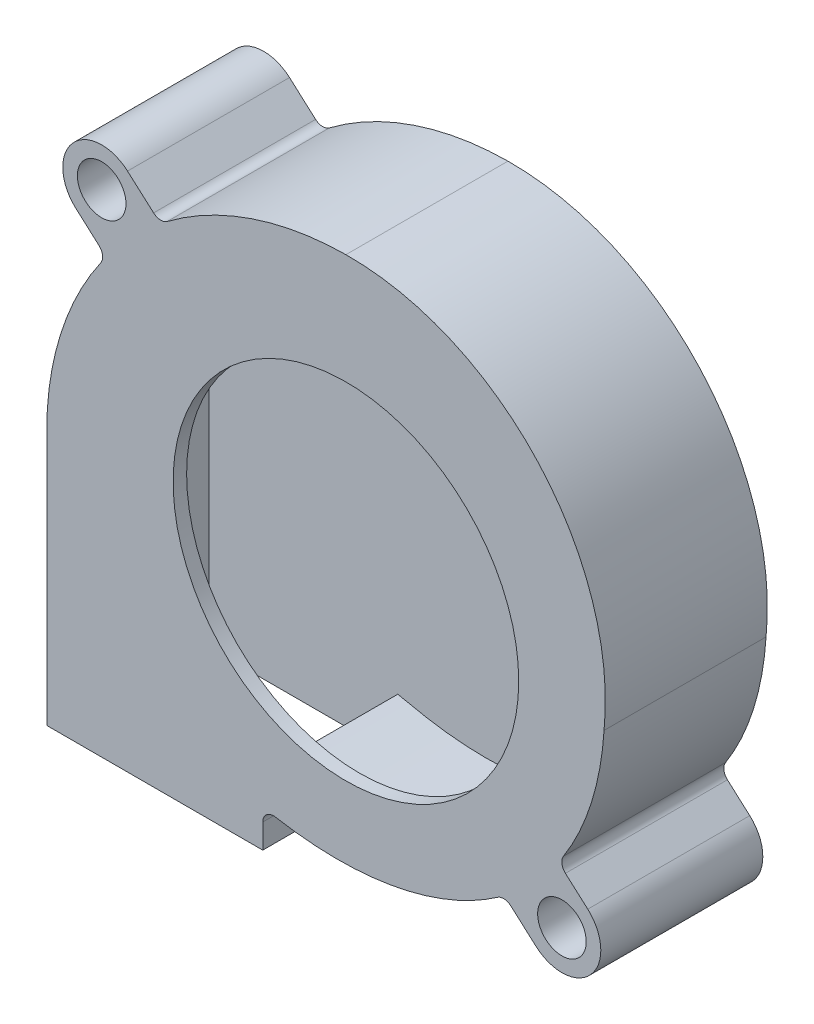
from build123d import *

# Parameters (mm, degrees)
BOSS_EXTRUDE1_DEPTH      = 7.5
BOSS_EXTRUDE1_DEPTH_BACK = 7.5
SKETCH2_R                = 2.25
SHELL1_START             = -6.25
SHELL1_DEPTH             = 12.5
CUT_EXTRUDE1_REACH       = 42.973
SKETCH3_R                = 16
FILLET1_R                = 1


# Read off the part's stored shape, not the designer's step: Shell1
with BuildPart() as part:
    # Sketch2 → Boss-Extrude1 (new, two sides: drawn at the far end of the back side and taken through both)
    with BuildSketch(Plane.XY.offset(-BOSS_EXTRUDE1_DEPTH_BACK)):
        with BuildLine():
            Line((-27.7, -1.754714302), (-27.7, -25.4))
            Line((-27.7, -25.4), (-7.7, -25.4))
            Line((-7.7, -25.4), (-7.7, -21.934994614))
            add(Edge.make_bspline(
                [(-7.7, -21.934994614), (1.089505829, -23.776714198), (8.970252681, -22.10862964), (14.671105933, -17.856437337)],
                knots=[0, 0, 0, 0, 0.517783655, 0.517783655, 0.517783655, 0.517783655], degree=3))
            Line((14.671105933, -17.856437337), (17.608394445, -20.467156716))
            ThreePointArc((17.608394445, -20.467156716), (22.690766223, -20.167996048), (22.391605555, -15.085624269))
            Line((22.391605555, -15.085624269), (19.673138844, -12.669397979))
            add(Edge.make_bspline(
                [(19.673138844, -12.669397979), (22.084739228, -9.177460006), (23.581545529, -4.890349215), (23.9, 0)],
                knots=[0.693538152, 0.693538152, 0.693538152, 0.693538152, 1, 1, 1, 1], degree=3))
            ThreePointArc((23.9, 0), (17.803458828, 18.439605572), (0, 26.2))
            ThreePointArc((0, 26.2), (-9.105433904, 24.587214818), (-17.186614263, 20.092270255))
            Line((-17.186614263, 20.092270255), (-20.222659144, 22.790766223))
            ThreePointArc((-20.222659144, 22.790766223), (-25.305030923, 22.491605555), (-25.005870255, 17.409233777))
            Line((-25.005870255, 17.409233777), (-22.191609365, 14.907863751))
            ThreePointArc((-22.191609365, 14.907863751), (-26.28720334, 7.020020377), (-27.7, -1.754714302))
        make_face()
        with Locations((20, -17.776390493)):
            Circle(SKETCH2_R, mode=Mode.SUBTRACT)
        with Locations((-22.6142647, 20.1)):
            Circle(SKETCH2_R, mode=Mode.SUBTRACT)
    extrude(amount=BOSS_EXTRUDE1_DEPTH + BOSS_EXTRUDE1_DEPTH_BACK)

    # Shell1 outline → Shell1 (cut)
    with BuildSketch(Plane.XY.offset(SHELL1_START)):
        with BuildLine():
            Line((19.622532896, -14.296804513), (18.016150224, -12.869020231))
            add(Edge.make_bspline(
                [(18.016150224, -12.869020231), (18.051576945, -12.817723211), (18.087003667, -12.766426191), (18.122430388, -12.715129171), (18.157857109, -12.66383215), (18.193283831, -12.612535131), (18.228710551, -12.56123811), (18.264137274, -12.50994109), (18.299563994, -12.45864407), (18.334990716, -12.40734705), (18.370417437, -12.35605003), (18.405844159, -12.30475301), (18.44127088, -12.25345599), (18.476697601, -12.20215897), (18.520981003, -12.138037694), (18.529837683, -12.125213439), (18.538694363, -12.112389184), (18.547551044, -12.099564929), (18.556407724, -12.086740674), (18.565264404, -12.073916419), (18.574121085, -12.061092164), (18.582977765, -12.048267909), (18.591834446, -12.035443654), (18.600691126, -12.022619399), (18.609547806, -12.009795144), (18.618404486, -11.996970889), (18.627261167, -11.984146634), (18.636671389, -11.970520863), (18.637224932, -11.969719347), (18.637778474, -11.968917831), (18.638332017, -11.968116315), (18.638885559, -11.967314799), (18.639439102, -11.966513284), (18.639992644, -11.965711767), (18.640546187, -11.964910252), (18.64109973, -11.964108735), (18.641653272, -11.96330722), (18.642206815, -11.962505704), (18.642760357, -11.961704188), (18.6433139, -11.960902672), (18.643936635, -11.960000966), (18.644007721, -11.959898036), (18.644065014, -11.959815075), (18.644167659, -11.959666454), (18.644187428, -11.959637822), (18.644283855, -11.9594982), (18.644383013, -11.959354625), (18.644395371, -11.959336729), (18.644469199, -11.959229822), (18.644608909, -11.959027533), (18.644602592, -11.959036679), (18.644696049, -11.958901353), (18.644756897, -11.958813245), (18.644887565, -11.958624032), (18.644952899, -11.958529425), (18.645018233, -11.958434817), (18.645083566, -11.958340209), (18.645148897, -11.958245601), (18.64521423, -11.958150993), (18.64527956, -11.958056383), (18.645344892, -11.957961774), (18.645410222, -11.957867163), (18.645475552, -11.957772553), (18.645540881, -11.957677942), (18.64560621, -11.957583331), (18.645671538, -11.957488719), (18.645867521, -11.957204882), (18.645998175, -11.957015655), (18.646128827, -11.956826427), (18.646259476, -11.956637197), (18.646390124, -11.956447965), (18.646520768, -11.956258731), (18.646651413, -11.956069496), (18.646782053, -11.955880258), (18.646912693, -11.95569102), (18.64704333, -11.955501779), (18.647173965, -11.955312536), (18.647304598, -11.955123292), (18.64743523, -11.954934045), (18.647827117, -11.954366301), (18.648088368, -11.953987798), (18.64834961, -11.953609287), (18.648610844, -11.95323077), (18.648872069, -11.952852245), (18.649133288, -11.952473713), (18.649394497, -11.952095174), (18.649655699, -11.951716627), (18.649916892, -11.951338074), (18.650178078, -11.950959513), (18.650439255, -11.950580945), (18.650700424, -11.95020237), (18.650961585, -11.949823787), (18.65226735, -11.947930839), (18.653311833, -11.946416366), (18.654356185, -11.944901777), (18.655400408, -11.943387074), (18.656444501, -11.941872255), (18.657488465, -11.940357322), (18.658532298, -11.938842273), (18.659576002, -11.937327109), (18.660619576, -11.93581183), (18.661663021, -11.934296437), (18.662706335, -11.932780928), (18.66374952, -11.931265304), (18.664792575, -11.929749565), (18.667921351, -11.925202003), (18.670006683, -11.922169835), (18.672091495, -11.919137207), (18.674175788, -11.916104119), (18.676259561, -11.913070571), (18.678342816, -11.910036563), (18.680425551, -11.907002096), (18.682507767, -11.903967167), (18.684589463, -11.90093178), (18.68667064, -11.897895932), (18.688751296, -11.894859625), (18.690831434, -11.891822858), (18.692911052, -11.888785631), (18.699148345, -11.879672571), (18.703304462, -11.873595358), (18.7074585, -11.867516307), (18.711610458, -11.861435418), (18.715760335, -11.85535269), (18.719908132, -11.849268125), (18.724053848, -11.843181721), (18.728197483, -11.83709348), (18.732339035, -11.831003402), (18.736478506, -11.824911486), (18.740615894, -11.818817734), (18.744751199, -11.812722145), (18.748884421, -11.80662472), (18.769540109, -11.776128414), (18.786031319, -11.751701992), (18.802489161, -11.727246206), (18.818913609, -11.702761073), (18.835304639, -11.678246607), (18.851662221, -11.653702823), (18.867986333, -11.629129738), (18.884276945, -11.604527363), (18.900534033, -11.579895716), (18.91675757, -11.555234811), (18.932947531, -11.530544664), (18.949103888, -11.505825288), (18.965226617, -11.4810767), (19.04567198, -11.357187769), (19.10948985, -11.25760948), (19.172767579, -11.157564989), (19.235503448, -11.057055241), (19.297695737, -10.956081176), (19.359342728, -10.85464374), (19.420442701, -10.752743874), (19.480993936, -10.650382523), (19.540994714, -10.547560629), (19.600443315, -10.444279135), (19.659338021, -10.340538985), (19.717677112, -10.236341121), (19.775458869, -10.131686486), (19.947126977, -9.816355101), (20.059335888, -9.604310842), (20.16929426, -9.390450666), (20.276987945, -9.174781998), (20.382402688, -8.957312267), (20.485524131, -8.738048908), (20.586337811, -8.516999358), (20.684829159, -8.294171063), (20.780983502, -8.06957147), (20.874786063, -7.843208033), (20.966221959, -7.61508821), (21.055276202, -7.385219464), (21.1419337, -7.153609263), (21.310424813, -6.686920896), (21.392258464, -6.45184282), (21.471664997, -6.215038335), (21.548629109, -5.976514973), (21.623135411, -5.736280308), (21.695168429, -5.494341964), (21.764712594, -5.250707611), (21.831752262, -5.005384963), (21.896271688, -4.758381783), (21.958255052, -4.50970588), (22.017686437, -4.259365107), (22.074549845, -4.007367366), (22.128829187, -3.753720604), (22.20634784, -3.370788921), (22.231537383, -3.242734734), (22.256074879, -3.114271279), (22.279958285, -2.985399584), (22.30318556, -2.856120672), (22.325754665, -2.726435571), (22.347663554, -2.596345306), (22.368910193, -2.465850903), (22.389492535, -2.334953386), (22.409408542, -2.203653784), (22.428656171, -2.07195312), (22.447233383, -1.939852421), (22.465138135, -1.807352712), (22.490983513, -1.608006173), (22.499430005, -1.54145784), (22.507707606, -1.474810151), (22.515816054, -1.408063241), (22.523755093, -1.341217241), (22.531524462, -1.274272285), (22.539123905, -1.207228504), (22.546553159, -1.140086033), (22.553811969, -1.072845002), (22.560900073, -1.005505546), (22.567817215, -0.938067797), (22.574563135, -0.870531887), (22.581137573, -0.80289795), (22.590741621, -0.701300201), (22.593900035, -0.667409811), (22.597015481, -0.633494965), (22.600087926, -0.59955568), (22.603117338, -0.565591972), (22.606103685, -0.531603859), (22.609046934, -0.497591356), (22.611947051, -0.463554482), (22.614804006, -0.429493253), (22.617617765, -0.395407686), (22.620388296, -0.361297797), (22.623115565, -0.327163604), (22.625799541, -0.293005124), (22.629760517, -0.241730997), (22.63107001, -0.224633554), (22.632368668, -0.207530045), (22.633656487, -0.190420473), (22.63493346, -0.17330484), (22.636199589, -0.156183147), (22.637454861, -0.139055398), (22.638699282, -0.121921594), (22.639932839, -0.104781737), (22.641155535, -0.087635829), (22.64236736, -0.070483873), (22.643568315, -0.053325871), (22.644758392, -0.036161825), (22.646232388, -0.014699214), (22.646526508, -0.010406314), (22.646819947, -0.006113037), (22.647112705, -0.001819382), (22.647404785, 0.00247465), (22.647696182, 0.00676906), (22.647986902, 0.011063848), (22.648276938, 0.015359013), (22.648566297, 0.019654555), (22.648854972, 0.023950474), (22.649142969, 0.028246771), (22.649430284, 0.032543446), (22.649716919, 0.036840497), (22.65014585, 0.04328664), (22.650288657, 0.045435449), (22.650431293, 0.047584352), (22.65057376, 0.049733349), (22.650716055, 0.051882441), (22.650858182, 0.054031626), (22.651000137, 0.056180907), (22.651141923, 0.058330281), (22.651283537, 0.06047975), (22.651424983, 0.062629313), (22.651566257, 0.06477897), (22.651707361, 0.066928721), (22.651848295, 0.069078567), (22.65202425, 0.071765992), (22.65205943, 0.072303483), (22.6520946, 0.07284098), (22.652129759, 0.073378482), (22.652164908, 0.073915991), (22.652200045, 0.074453505), (22.652235173, 0.074991026), (22.652270288, 0.075528552), (22.652305395, 0.076066084), (22.652340489, 0.076603622), (22.652375574, 0.077141166), (22.652410648, 0.077678716), (22.652445711, 0.078216272), (22.652489527, 0.078888224), (22.652498289, 0.079022614), (22.652507051, 0.079157006), (22.652515812, 0.079291397), (22.652524573, 0.079425789), (22.652533332, 0.079560181), (22.652542092, 0.079694574), (22.65255085, 0.079828967), (22.652559608, 0.07996336), (22.652568365, 0.080097754), (22.652577122, 0.080232148), (22.652585877, 0.080366542), (22.652594633, 0.080500937), (22.652612142, 0.080769727), (22.652621626, 0.080915337), (22.652624364, 0.080957354), (22.652656726, 0.081454433), (22.652609826, 0.080733725), (22.652702072, 0.08215146), (22.652629159, 0.081030098), (22.652694632, 0.082037175), (22.652676876, 0.081763348), (22.65269448, 0.082034275), (22.652702142, 0.082151727), (22.652711317, 0.082292672), (22.652720479, 0.08243336), (22.65274789, 0.082854297), (22.652766164, 0.083134921), (22.652784438, 0.083415546), (22.652802712, 0.08369617), (22.652820985, 0.083976794), (22.652839261, 0.084257419), (22.652857533, 0.084538043), (22.652875809, 0.084818668), (22.652894081, 0.085099292), (22.652912356, 0.085379917), (22.652930629, 0.085660541), (22.652948904, 0.085941166), (22.652967178, 0.08622179), (22.653058548, 0.087624912), (22.653131643, 0.08874741), (22.653204739, 0.089869908), (22.653277835, 0.090992406), (22.653350932, 0.092114904), (22.653424026, 0.093237402), (22.653497124, 0.094359899), (22.653570218, 0.095482397), (22.653643315, 0.096604895), (22.65371641, 0.097727393), (22.653789507, 0.098849891), (22.653862602, 0.099972389), (22.653935698, 0.101094887), (22.654016655, 0.102338098), (22.654024516, 0.102458811), (22.654032376, 0.102579524), (22.654040237, 0.102700237), (22.654048098, 0.10282095), (22.654055958, 0.102941663), (22.654063819, 0.103062376), (22.65407168, 0.103183089), (22.654079541, 0.103303803), (22.654087401, 0.103424516), (22.654095262, 0.103545229), (22.654103123, 0.103665942), (22.654110983, 0.103786655), (22.654118844, 0.103907368)],
                knots=[0.666917962, 0.666917962, 0.666917962, 0.666917962, 0.666917962, 0.666917962, 0.666917962, 0.666917962, 0.666917962, 0.666917962, 0.666917962, 0.666917962, 0.666917962, 0.666917962, 0.666917962, 0.687927128, 0.687927128, 0.687927128, 0.687927128, 0.687927128, 0.687927128, 0.687927128, 0.687927128, 0.687927128, 0.687927128, 0.687927128, 0.687927128, 0.687927128, 0.693179419, 0.693179419, 0.693179419, 0.693179419, 0.693179419, 0.693179419, 0.693179419, 0.693179419, 0.693179419, 0.693179419, 0.693179419, 0.693179419, 0.693179419, 0.693507688, 0.693507688, 0.693507688, 0.693507688, 0.693507688, 0.693507688, 0.693507688, 0.693507688, 0.693507688, 0.693507688, 0.693507688, 0.693507688, 0.693507688, 0.693548721, 0.693548721, 0.693548721, 0.693548721, 0.693548721, 0.693548721, 0.693548721, 0.693548721, 0.693548721, 0.693548721, 0.693548721, 0.693548721, 0.693548721, 0.693589755, 0.693589755, 0.693589755, 0.693589755, 0.693589755, 0.693589755, 0.693589755, 0.693589755, 0.693589755, 0.693589755, 0.693589755, 0.693589755, 0.693589755, 0.693671822, 0.693671822, 0.693671822, 0.693671822, 0.693671822, 0.693671822, 0.693671822, 0.693671822, 0.693671822, 0.693671822, 0.693671822, 0.693671822, 0.693671822, 0.693835956, 0.693835956, 0.693835956, 0.693835956, 0.693835956, 0.693835956, 0.693835956, 0.693835956, 0.693835956, 0.693835956, 0.693835956, 0.693835956, 0.693835956, 0.694492492, 0.694492492, 0.694492492, 0.694492492, 0.694492492, 0.694492492, 0.694492492, 0.694492492, 0.694492492, 0.694492492, 0.694492492, 0.694492492, 0.694492492, 0.695805565, 0.695805565, 0.695805565, 0.695805565, 0.695805565, 0.695805565, 0.695805565, 0.695805565, 0.695805565, 0.695805565, 0.695805565, 0.695805565, 0.695805565, 0.698431711, 0.698431711, 0.698431711, 0.698431711, 0.698431711, 0.698431711, 0.698431711, 0.698431711, 0.698431711, 0.698431711, 0.698431711, 0.698431711, 0.698431711, 0.708936294, 0.708936294, 0.708936294, 0.708936294, 0.708936294, 0.708936294, 0.708936294, 0.708936294, 0.708936294, 0.708936294, 0.708936294, 0.708936294, 0.708936294, 0.750954626, 0.750954626, 0.750954626, 0.750954626, 0.750954626, 0.750954626, 0.750954626, 0.750954626, 0.750954626, 0.750954626, 0.750954626, 0.750954626, 0.750954626, 0.83499129, 0.83499129, 0.83499129, 0.83499129, 0.83499129, 0.83499129, 0.83499129, 0.83499129, 0.83499129, 0.83499129, 0.83499129, 0.83499129, 0.83499129, 0.919027954, 0.919027954, 0.919027954, 0.919027954, 0.919027954, 0.919027954, 0.919027954, 0.919027954, 0.919027954, 0.919027954, 0.919027954, 0.919027954, 0.919027954, 0.961046286, 0.961046286, 0.961046286, 0.961046286, 0.961046286, 0.961046286, 0.961046286, 0.961046286, 0.961046286, 0.961046286, 0.961046286, 0.961046286, 0.961046286, 0.982055452, 0.982055452, 0.982055452, 0.982055452, 0.982055452, 0.982055452, 0.982055452, 0.982055452, 0.982055452, 0.982055452, 0.982055452, 0.982055452, 0.982055452, 0.992560035, 0.992560035, 0.992560035, 0.992560035, 0.992560035, 0.992560035, 0.992560035, 0.992560035, 0.992560035, 0.992560035, 0.992560035, 0.992560035, 0.992560035, 0.997812327, 0.997812327, 0.997812327, 0.997812327, 0.997812327, 0.997812327, 0.997812327, 0.997812327, 0.997812327, 0.997812327, 0.997812327, 0.997812327, 0.997812327, 0.9991254, 0.9991254, 0.9991254, 0.9991254, 0.9991254, 0.9991254, 0.9991254, 0.9991254, 0.9991254, 0.9991254, 0.9991254, 0.9991254, 0.9991254, 0.999781936, 0.999781936, 0.999781936, 0.999781936, 0.999781936, 0.999781936, 0.999781936, 0.999781936, 0.999781936, 0.999781936, 0.999781936, 0.999781936, 0.999781936, 0.99994607, 0.99994607, 0.99994607, 0.99994607, 0.99994607, 0.99994607, 0.99994607, 0.99994607, 0.99994607, 0.99994607, 0.99994607, 0.99994607, 0.99994607, 0.999987104, 0.999987104, 0.999987104, 0.999987104, 0.999987104, 0.999987104, 0.999987104, 0.999987104, 0.999987104, 0.999987104, 0.999987104, 0.999987104, 0.999987104, 1.000028137, 1.000028137, 1.000028137, 1.000028137, 1.000028137, 1.000028137, 1.000028137, 1.000028137, 1.000028137, 1.000028137, 1.000028137, 1.000028137, 1.000028137, 1.000110205, 1.000110205, 1.000110205, 1.000110205, 1.000110205, 1.000110205, 1.000110205, 1.000110205, 1.000110205, 1.000110205, 1.000110205, 1.000110205, 1.000110205, 1.000438473, 1.000438473, 1.000438473, 1.000438473, 1.000438473, 1.000438473, 1.000438473, 1.000438473, 1.000438473, 1.000438473, 1.000438473, 1.000438473, 1.000438473, 1.000473775, 1.000473775, 1.000473775, 1.000473775, 1.000473775, 1.000473775, 1.000473775, 1.000473775, 1.000473775, 1.000473775, 1.000473775, 1.000473775, 1.000473775, 1.000473775, 1.000473775], degree=14))
            ThreePointArc((22.654118844, 0.103907368), (16.887423541, 17.589012543), (0.011441482, 24.950052364))
            ThreePointArc((0.011441482, 24.950052364), (-9.179774467, 23.228732983), (-17.214144884, 18.44435392))
            Line((-17.214144884, 18.44435392), (-19.114423676, 20.133358812))
            ThreePointArc((-19.114423676, 20.133358812), (-19.998241983, 17.774827932), (-22.236797596, 16.620414021))
            Line((-22.236797596, 16.620414021), (-20.48740424, 15.06551905))
            ThreePointArc((-20.48740424, 15.06551905), (-24.915251155, 7.168188788), (-26.45, -1.754714302))
            Line((-26.45, -1.754714302), (-26.45, -25.4))
            Line((-26.45, -25.4), (-8.95, -25.4))
            Line((-8.95, -25.4), (-8.95, -20.395928254))
            add(Edge.make_bspline(
                [(-8.95, -20.395928254), (-8.879967103, -20.41060268), (-8.809934206, -20.425277107), (-8.739901309, -20.439951533), (-8.669868412, -20.45462596), (-8.599835515, -20.469300386), (-8.529802618, -20.483974813), (-8.459769721, -20.498649239), (-8.389736824, -20.513323666), (-8.319703927, -20.527998093), (-8.24967103, -20.542672519), (-8.179638133, -20.557346946), (-8.109605236, -20.572021373), (-8.00455589, -20.594033012), (-7.969539442, -20.601370226), (-7.934522993, -20.608707439), (-7.899506544, -20.616044652), (-7.864490096, -20.623381866), (-7.829473647, -20.630719079), (-7.794457199, -20.638056292), (-7.75944075, -20.645393505), (-7.724424302, -20.652730719), (-7.689407853, -20.660067932), (-7.654391405, -20.667405145), (-7.619374956, -20.674742359), (-7.575604396, -20.683913875), (-7.566850284, -20.685748179), (-7.558096171, -20.687582482), (-7.549342059, -20.689416785), (-7.540587947, -20.691251089), (-7.531833835, -20.693085392), (-7.523079723, -20.694919695), (-7.514325611, -20.696753999), (-7.505571499, -20.698588302), (-7.496817387, -20.700422605), (-7.488063274, -20.702256908), (-7.479309162, -20.704091212), (-7.469460786, -20.706154803), (-7.468366522, -20.706384091), (-7.467272258, -20.706613379), (-7.466177994, -20.706842667), (-7.46508373, -20.707071955), (-7.463989466, -20.707301243), (-7.462895202, -20.707530531), (-7.461800938, -20.707759818), (-7.460706674, -20.707989106), (-7.45961241, -20.708218394), (-7.458518146, -20.708447682), (-7.457423882, -20.70867697), (-7.455782486, -20.709020902), (-7.455235354, -20.709135546), (-7.454688222, -20.70925019), (-7.45414109, -20.709364834), (-7.453593958, -20.709479478), (-7.453046826, -20.709594122), (-7.452499694, -20.709708766), (-7.451952562, -20.70982341), (-7.45140543, -20.709938054), (-7.450858298, -20.710052698), (-7.450311166, -20.710167342), (-7.449764034, -20.710281986), (-7.448943336, -20.710453951), (-7.44866977, -20.710511273), (-7.448396204, -20.710568595), (-7.448122638, -20.710625917), (-7.447849072, -20.710683239), (-7.447575506, -20.710740561), (-7.44730194, -20.710797883), (-7.447028374, -20.710855205), (-7.446754808, -20.710912527), (-7.446481242, -20.710969849), (-7.446207676, -20.711027171), (-7.44593411, -20.711084493), (-7.445523761, -20.711170476), (-7.445386978, -20.711199137), (-7.445250195, -20.711227798), (-7.445113412, -20.711256459), (-7.444976629, -20.71128512), (-7.444839846, -20.711313781), (-7.444703063, -20.711342442), (-7.44456628, -20.711371103), (-7.444429497, -20.711399764), (-7.444292714, -20.711428425), (-7.444155931, -20.711457086), (-7.444019148, -20.711485747), (-7.443745582, -20.711543069), (-7.443605589, -20.711572403), (-7.443475817, -20.711599595), (-7.443347829, -20.711626412), (-7.443215786, -20.711654079), (-7.44308089, -20.711682342), (-7.442947139, -20.711710365), (-7.442816245, -20.711737789), (-7.44268608, -20.71176506), (-7.442553546, -20.711792827), (-7.44241929, -20.711820953), (-7.442288176, -20.711848421), (-7.440040957, -20.712319196), (-7.437925972, -20.712762124), (-7.43581103, -20.713204901), (-7.433696133, -20.713647524), (-7.431581279, -20.714089994), (-7.42946647, -20.714532312), (-7.427351704, -20.714974476), (-7.425236983, -20.715416488), (-7.423122306, -20.715858347), (-7.421007673, -20.716300053), (-7.418893084, -20.716741607), (-7.41677854, -20.717183007), (-7.410435038, -20.71850675), (-7.406206213, -20.719388634), (-7.401977564, -20.720269907), (-7.397749093, -20.721150569), (-7.393520797, -20.722030619), (-7.389292679, -20.722910059), (-7.385064737, -20.723788887), (-7.380836972, -20.724667105), (-7.376609384, -20.725544711), (-7.372381972, -20.726421706), (-7.368154737, -20.727298091), (-7.36392768, -20.728173864), (-7.342793275, -20.732549677), (-7.325888583, -20.736040554), (-7.308986725, -20.739521659), (-7.292087703, -20.742992996), (-7.27519152, -20.746454565), (-7.25829818, -20.749906371), (-7.241407684, -20.753348414), (-7.224520036, -20.756780698), (-7.207635238, -20.760203225), (-7.190753293, -20.763615997), (-7.173874204, -20.767019017), (-7.156997974, -20.770412287), (-7.005137653, -20.800863985), (-6.870333839, -20.827308309), (-6.735714564, -20.853129997), (-6.601281224, -20.878330267), (-6.467035219, -20.902910335), (-6.332977948, -20.926871418), (-6.199110809, -20.950214732), (-6.065435201, -20.972941495), (-5.931952523, -20.995052923), (-5.798664173, -21.016550234), (-5.665571549, -21.037434643), (-5.532676052, -21.057707367), (-5.134585132, -21.116694138), (-4.869985217, -21.153576784), (-4.606190462, -21.188027311), (-4.343211966, -21.220055469), (-4.081060795, -21.249671005), (-3.819747989, -21.27688367), (-3.559284555, -21.301703209), (-3.299681472, -21.324139372), (-3.040949689, -21.344201906), (-2.783100124, -21.361900558), (-2.526143667, -21.377245074), (-2.270091177, -21.390245202), (-1.504678093, -21.422241656), (-0.998061782, -21.434233714), (-0.495191246, -21.43696511), (0.003847391, -21.430513869), (0.498968576, -21.414957797), (0.990087332, -21.390374479), (1.477119251, -21.356841278), (1.959980499, -21.314435339), (2.438587816, -21.263233582), (2.912858513, -21.203312709), (3.382710474, -21.134749199), (3.848062156, -21.057619313), (4.769603018, -20.886378864), (5.225792085, -20.792267507), (5.67731905, -20.689741164), (6.124103702, -20.578875315), (6.566066349, -20.459744782), (7.003127825, -20.332423722), (7.435209485, -20.19698563), (7.862233207, -20.053503339), (8.28412139, -19.90204902), (8.70079696, -19.74269418), (9.112183361, -19.575509665), (9.518204562, -19.400565658), (10.119075303, -19.12661469), (10.318005296, -19.033375084), (10.51556558, -18.938221503), (10.711746711, -18.841162523), (10.906539263, -18.742206662), (11.099933819, -18.64136237), (11.29192098, -18.538638038), (11.482491359, -18.434041992), (11.671635584, -18.327582497), (11.859344295, -18.219267753), (12.04560815, -18.1091059), (12.230417816, -17.997105011), (12.505437058, -17.826357147), (12.596744258, -17.768983474), (12.687684411, -17.711153061), (12.778256351, -17.652866887), (12.868458909, -17.594125932), (12.95829092, -17.534931172), (13.047751217, -17.47528359), (13.136838631, -17.41518416), (13.225551998, -17.354633864), (13.313890149, -17.293633679), (13.401851919, -17.232184585), (13.489436139, -17.17028756), (13.59844302, -17.09235759), (13.620220726, -17.076743658), (13.641974744, -17.061101806), (13.663705056, -17.045432045), (13.685411644, -17.029734393), (13.707094488, -17.014008863), (13.728753571, -16.998255471), (13.750388875, -16.982474231), (13.772000381, -16.966665159), (13.793588071, -16.950828268), (13.815151927, -16.934963575), (13.836691931, -16.919071093), (13.86089758, -16.901160806), (13.863586724, -16.89917034), (13.866275494, -16.89717944), (13.868963892, -16.895188106), (13.871651916, -16.893196339), (13.874339568, -16.891204137), (13.877026846, -16.889211502), (13.879713751, -16.887218433), (13.882400283, -16.88522493), (13.885086441, -16.883230994), (13.887772226, -16.881236624), (13.890457638, -16.87924182), (13.894485196, -16.876248964), (13.895827622, -16.875251236), (13.897169954, -16.874253401), (13.898512194, -16.873255457), (13.899854339, -16.872257405), (13.901196392, -16.871259244), (13.902538351, -16.870260975), (13.903880217, -16.869262597), (13.905221989, -16.868264111), (13.906563668, -16.867265517), (13.907905254, -16.866266814), (13.909246746, -16.865268003), (13.911258844, -16.863769624), (13.91192952, -16.863270137), (13.912600173, -16.862770623), (13.913270802, -16.862271082), (13.913941408, -16.861771514), (13.914611991, -16.861271919), (13.91528255, -16.860772297), (13.915953086, -16.860272647), (13.916623599, -16.859772971), (13.917294088, -16.859273267), (13.917964554, -16.858773537), (13.918634997, -16.858273779), (13.919640625, -16.857524102), (13.919975829, -16.857274202), (13.920311027, -16.857024297), (13.920646219, -16.856774384), (13.920981405, -16.856524464), (13.921316586, -16.856274538), (13.92165176, -16.856024605), (13.921986929, -16.855774665), (13.922322092, -16.855524719), (13.922657249, -16.855274765), (13.9229924, -16.855024805), (13.923327546, -16.854774838), (13.923830255, -16.854399878), (13.923992275, -16.854279026), (13.924297546, -16.854051334), (13.92410082, -16.854198063), (13.924981362, -16.853541283), (13.924212736, -16.85411459), (13.925334235, -16.853278077), (13.924808534, -16.853670192), (13.925371285, -16.853250442), (13.925399495, -16.853229401), (13.925614179, -16.853069271), (13.925786988, -16.852940375), (13.926141857, -16.852675683), (13.926319291, -16.852543337), (13.926496725, -16.852410991), (13.92667416, -16.852278645), (13.926851594, -16.852146299), (13.927029028, -16.852013954), (13.927206462, -16.851881608), (13.927383897, -16.851749262), (13.927561331, -16.851616916), (13.927738765, -16.85148457), (13.9279162, -16.851352224), (13.928093634, -16.851219878), (13.933948965, -16.846852463), (13.939626862, -16.842617393), (13.945304759, -16.838382324), (13.950982656, -16.834147254), (13.956660553, -16.829912185), (13.96233845, -16.825677115), (13.968016347, -16.821442046), (13.973694244, -16.817206976), (13.979372141, -16.812971907), (13.985050038, -16.808736837), (13.990727935, -16.804501767), (13.996405832, -16.800266698), (14.013439523, -16.787561489), (14.024795317, -16.77909135), (14.036151111, -16.770621211), (14.047506905, -16.762151072), (14.058862699, -16.753680933), (14.070218493, -16.745210794), (14.081574286, -16.736740655), (14.092930081, -16.728270516), (14.104285874, -16.719800377), (14.115641668, -16.711330238), (14.126997462, -16.702860099), (14.138353256, -16.69438996), (14.195132226, -16.652039265), (14.240555402, -16.618158709), (14.285978578, -16.584278152), (14.331401754, -16.550397596), (14.37682493, -16.51651704), (14.422248105, -16.482636484), (14.467671281, -16.448755928), (14.513094457, -16.414875372), (14.558517633, -16.380994816), (14.603940809, -16.347114259), (14.649363985, -16.313233703), (14.69478716, -16.279353147), (14.740210336, -16.245472591)],
                knots=[-0.029579402, -0.029579402, -0.029579402, -0.029579402, -0.029579402, -0.029579402, -0.029579402, -0.029579402, -0.029579402, -0.029579402, -0.029579402, -0.029579402, -0.029579402, -0.029579402, -0.01170185, -0.01170185, -0.01170185, -0.01170185, -0.01170185, -0.01170185, -0.01170185, -0.01170185, -0.01170185, -0.01170185, -0.01170185, -0.01170185, -0.002763073, -0.002763073, -0.002763073, -0.002763073, -0.002763073, -0.002763073, -0.002763073, -0.002763073, -0.002763073, -0.002763073, -0.002763073, -0.002763073, -0.000528379, -0.000528379, -0.000528379, -0.000528379, -0.000528379, -0.000528379, -0.000528379, -0.000528379, -0.000528379, -0.000528379, -0.000528379, -0.000528379, -0.000249042, -0.000249042, -0.000249042, -0.000249042, -0.000249042, -0.000249042, -0.000249042, -0.000249042, -0.000249042, -0.000249042, -0.000249042, -0.000249042, -0.000109374, -0.000109374, -0.000109374, -0.000109374, -0.000109374, -0.000109374, -0.000109374, -0.000109374, -0.000109374, -0.000109374, -0.000109374, -0.000109374, -3.954e-05, -3.954e-05, -3.954e-05, -3.954e-05, -3.954e-05, -3.954e-05, -3.954e-05, -3.954e-05, -3.954e-05, -3.954e-05, -3.954e-05, -3.954e-05, -4.623e-06, -4.623e-06, -4.623e-06, -4.623e-06, -4.623e-06, -4.623e-06, -4.623e-06, -4.623e-06, -4.623e-06, -4.623e-06, -4.623e-06, -4.623e-06, 3.0294e-05, 3.0294e-05, 3.0294e-05, 3.0294e-05, 3.0294e-05, 3.0294e-05, 3.0294e-05, 3.0294e-05, 3.0294e-05, 3.0294e-05, 3.0294e-05, 3.0294e-05, 0.000588968, 0.000588968, 0.000588968, 0.000588968, 0.000588968, 0.000588968, 0.000588968, 0.000588968, 0.000588968, 0.000588968, 0.000588968, 0.000588968, 0.001706315, 0.001706315, 0.001706315, 0.001706315, 0.001706315, 0.001706315, 0.001706315, 0.001706315, 0.001706315, 0.001706315, 0.001706315, 0.001706315, 0.006175703, 0.006175703, 0.006175703, 0.006175703, 0.006175703, 0.006175703, 0.006175703, 0.006175703, 0.006175703, 0.006175703, 0.006175703, 0.006175703, 0.041930809, 0.041930809, 0.041930809, 0.041930809, 0.041930809, 0.041930809, 0.041930809, 0.041930809, 0.041930809, 0.041930809, 0.041930809, 0.041930809, 0.11344102, 0.11344102, 0.11344102, 0.11344102, 0.11344102, 0.11344102, 0.11344102, 0.11344102, 0.11344102, 0.11344102, 0.11344102, 0.11344102, 0.256461442, 0.256461442, 0.256461442, 0.256461442, 0.256461442, 0.256461442, 0.256461442, 0.256461442, 0.256461442, 0.256461442, 0.256461442, 0.256461442, 0.399481864, 0.399481864, 0.399481864, 0.399481864, 0.399481864, 0.399481864, 0.399481864, 0.399481864, 0.399481864, 0.399481864, 0.399481864, 0.399481864, 0.470992075, 0.470992075, 0.470992075, 0.470992075, 0.470992075, 0.470992075, 0.470992075, 0.470992075, 0.470992075, 0.470992075, 0.470992075, 0.470992075, 0.50674718, 0.50674718, 0.50674718, 0.50674718, 0.50674718, 0.50674718, 0.50674718, 0.50674718, 0.50674718, 0.50674718, 0.50674718, 0.50674718, 0.515685957, 0.515685957, 0.515685957, 0.515685957, 0.515685957, 0.515685957, 0.515685957, 0.515685957, 0.515685957, 0.515685957, 0.515685957, 0.515685957, 0.516803304, 0.516803304, 0.516803304, 0.516803304, 0.516803304, 0.516803304, 0.516803304, 0.516803304, 0.516803304, 0.516803304, 0.516803304, 0.516803304, 0.517361977, 0.517361977, 0.517361977, 0.517361977, 0.517361977, 0.517361977, 0.517361977, 0.517361977, 0.517361977, 0.517361977, 0.517361977, 0.517361977, 0.517641314, 0.517641314, 0.517641314, 0.517641314, 0.517641314, 0.517641314, 0.517641314, 0.517641314, 0.517641314, 0.517641314, 0.517641314, 0.517641314, 0.517780983, 0.517780983, 0.517780983, 0.517780983, 0.517780983, 0.517780983, 0.517780983, 0.517780983, 0.517780983, 0.517780983, 0.517780983, 0.517780983, 0.517850817, 0.517850817, 0.517850817, 0.517850817, 0.517850817, 0.517850817, 0.517850817, 0.517850817, 0.517850817, 0.517850817, 0.517850817, 0.517850817, 0.517920651, 0.517920651, 0.517920651, 0.517920651, 0.517920651, 0.517920651, 0.517920651, 0.517920651, 0.517920651, 0.517920651, 0.517920651, 0.517920651, 0.520155345, 0.520155345, 0.520155345, 0.520155345, 0.520155345, 0.520155345, 0.520155345, 0.520155345, 0.520155345, 0.520155345, 0.520155345, 0.520155345, 0.524624733, 0.524624733, 0.524624733, 0.524624733, 0.524624733, 0.524624733, 0.524624733, 0.524624733, 0.524624733, 0.524624733, 0.524624733, 0.524624733, 0.542502286, 0.542502286, 0.542502286, 0.542502286, 0.542502286, 0.542502286, 0.542502286, 0.542502286, 0.542502286, 0.542502286, 0.542502286, 0.542502286, 0.542502286, 0.542502286], degree=13))
            Line((14.740210336, -16.245472591), (16.500158977, -17.809749305))
            ThreePointArc((16.500158977, -17.809749305), (17.383977283, -15.451218425), (19.622532896, -14.296804513))
        make_face()
    extrude(amount=SHELL1_DEPTH, mode=Mode.SUBTRACT)

    # Sketch3 → Cut-Extrude1 (cut, up to next)
    with BuildSketch(Plane.XY.offset(7.5), mode=Mode.PRIVATE) as cut_extrude1_sk1:
        Circle(SKETCH3_R)
    cut_extrude1_tool1 = extrude(cut_extrude1_sk1.sketch, amount=-CUT_EXTRUDE1_REACH, mode=Mode.PRIVATE) & part.part
    add(cut_extrude1_tool1.solids().sort_by_distance((0, 0, 7.5))[0], mode=Mode.SUBTRACT)

    # Fillet1
    fillet1_edges = [part.edges().sort_by_distance(p)[0] for p in [
        (-22.191609365, 14.907863751, 0),
        (-17.186614263, 20.092270255, 0),
        (19.673138844, -12.669397979, 3.75),
        (14.671105933, -17.856437337, 3.75),
        (-7.7, -21.934994614, 3.75),
    ]]
    fillet(fillet1_edges, radius=FILLET1_R)


solid = part.part
